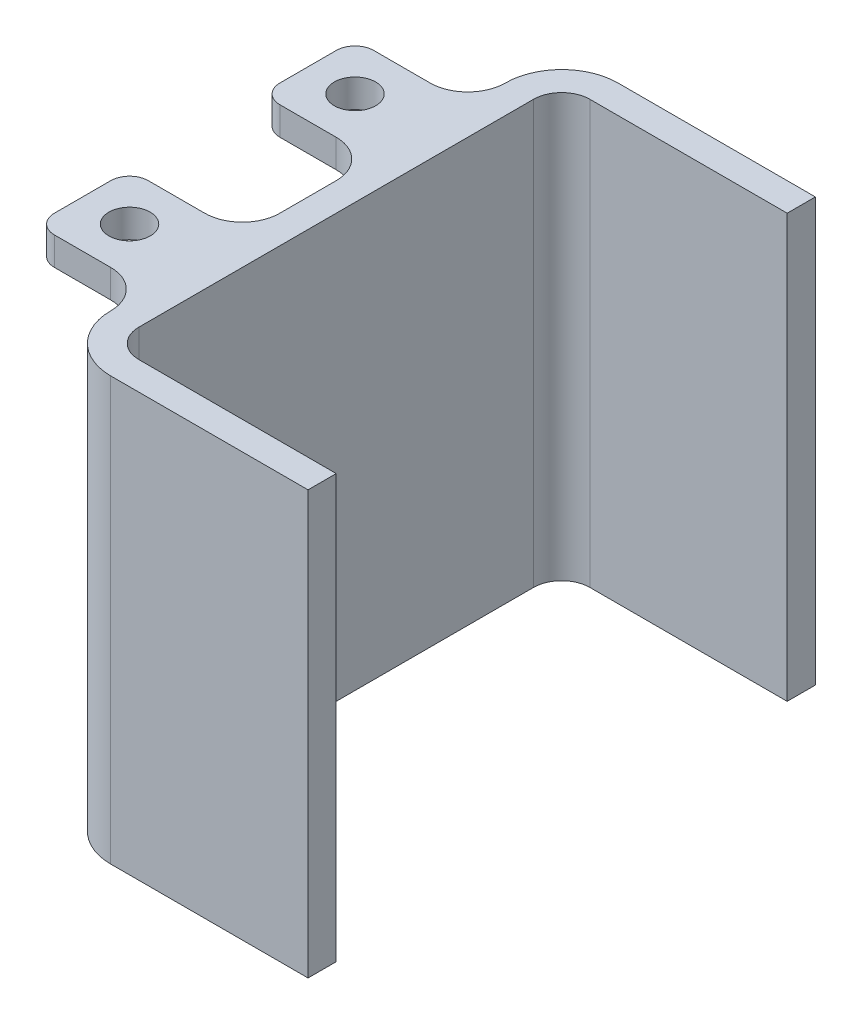
from build123d import *

# Parameters (mm, degrees)
BOSS_EXTRUDE1_DEPTH = 45
SKETCH4_W           = 12
SKETCH4_H           = 10
SKETCH4_R           = 2.2
BOSS_EXTRUDE2_DEPTH = 3
FILLET1_R           = 4
FILLET2_R           = 2
FILLET3_R           = 2


with BuildPart() as part:
    # Sketch3 → Boss-Extrude1 (new body)
    with BuildSketch(Plane(origin=(0, 0, 0), x_dir=(1, 0, 0), z_dir=(0, 1, 0))):
        with BuildLine():
            Line((-8, 24), (-29, 24))
            ThreePointArc((-29, 24), (-31.121320344, 23.121320344), (-32, 21))
            Line((-32, 21), (-32, -21))
            ThreePointArc((-32, -21), (-31.121320344, -23.121320344), (-29, -24))
            Line((-29, -24), (-8, -24))
            Line((-8, -24), (-8, -27))
            Line((-8, -27), (-29, -27))
            ThreePointArc((-29, -27), (-33.242640687, -25.242640687), (-35, -21))
            Line((-35, -21), (-35, 21))
            ThreePointArc((-35, 21), (-33.242640687, 25.242640687), (-29, 27))
            Line((-29, 27), (-8, 27))
            Line((-8, 27), (-8, 24))
        make_face()
    extrude(amount=BOSS_EXTRUDE1_DEPTH)

    # Sketch4 → Boss-Extrude2 (add)
    # profile 1 of 2: a face of its own
    with BuildSketch(Plane(origin=(0, 45, 0), x_dir=(1, 0, 0), z_dir=(0, 1, 0))):
        with Locations((-41, 12)):
            Rectangle(SKETCH4_W, SKETCH4_H)
        with Locations(Location((-42, 12, 0), (0, 0, 270))):
            Circle(SKETCH4_R, mode=Mode.SUBTRACT)
    # profile 2 of 2: a face of its own
    with BuildSketch(Plane(origin=(0, 45, 0), x_dir=(1, 0, 0), z_dir=(0, 1, 0))):
        with Locations((-41, -12)):
            Rectangle(SKETCH4_W, SKETCH4_H)
        with Locations(Location((-42, -12, 0), (0, 0, 270))):
            Circle(SKETCH4_R, mode=Mode.SUBTRACT)
    extrude(amount=-BOSS_EXTRUDE2_DEPTH)

    # Fillet1
    fillet1_edges = [part.edges().sort_by_distance(p)[0] for p in [
        (-35, 43.5, -17),
        (-35, 43.5, -7),
        (-35, 43.5, 7),
        (-35, 43.5, 17),
    ]]
    fillet(fillet1_edges, radius=FILLET1_R - 0.0001)  # a hair under: the kernel refuses the full size

    # Fillet2
    fillet2_edges = [part.edges().sort_by_distance(p)[0] for p in [
        (-35, 42, -12),
        (-35, 42, 12),
    ]]
    fillet(fillet2_edges, radius=FILLET2_R)

    # Fillet3
    fillet3_edges = [part.edges().sort_by_distance(p)[0] for p in [
        (-47, 43.5, -7),
        (-47, 43.5, -17),
        (-47, 43.5, 17),
        (-47, 43.5, 7),
    ]]
    fillet(fillet3_edges, radius=FILLET3_R)


solid = part.part
